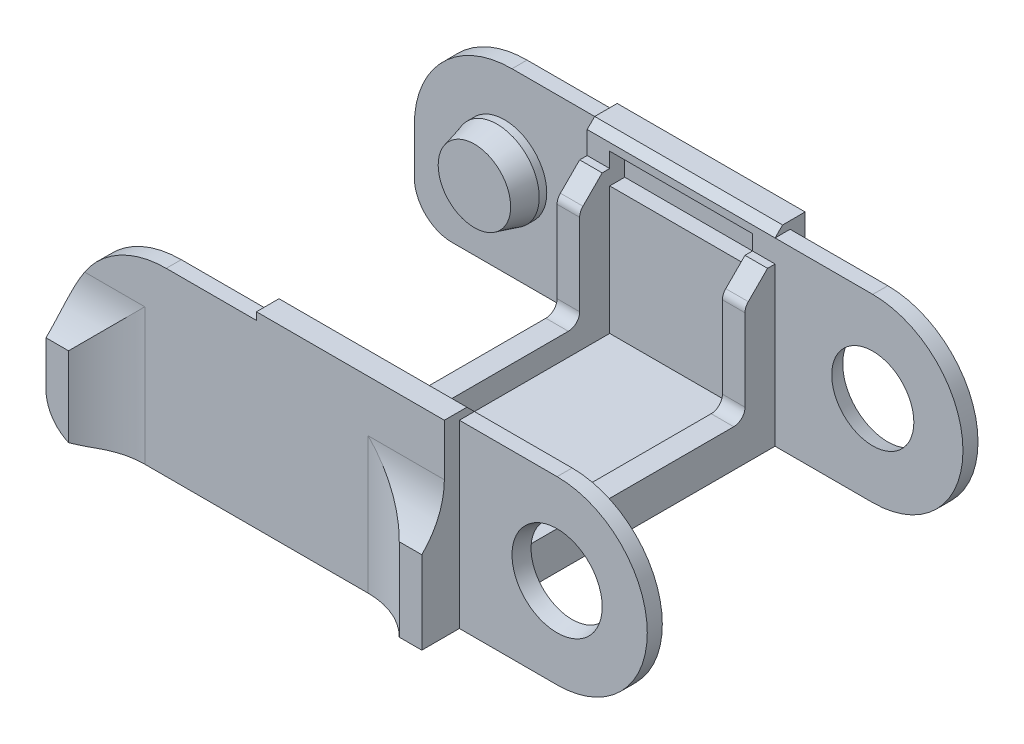
from build123d import *

# Parameters (mm, degrees)
SKETCH_1_W             = 25
SKETCH_1_H             = 25
EXTRUDE_1_DEPTH        = 4
SKETCH_2_W             = 25
SKETCH_2_H             = 24
EXTRUDE_2_DEPTH        = 2
SKETCH_3_R             = 5.625
EXTRUDE_3_DEPTH        = 4
CHAMFER_1_SIZE         = 3
CHAMFER_1_SIZE2        = 0.803847577
EXTRUDE_4_DEPTH        = 2
SKETCH_6_R             = 5
CUT_EXTRUDE_2_DEPTH    = 10
EXTRUDE_6_DEPTH        = 20
SKETCH_9_W             = 19
SKETCH_9_H             = 3
CUT_EXTRUDE_4_DEPTH    = 2
CHAMFER_2_SIZE         = 1
CHAMFER_3_SIZE         = 3.732050808
CHAMFER_3_SIZE_2       = 1
FILLET_1_R             = 13
CHAMFER_4_SIZE         = 1
SKETCH_11_W            = 3
SKETCH_11_H            = 4
EXTRUDE_7_DEPTH        = 16
PATTERN_LINEAR_1_COUNT = 2
PATTERN_LINEAR_1_PITCH = 22
CHAMFER_6_SIZE         = 3
FILLET_2_R             = 1.5
SKETCH1_W              = 3
SKETCH1_H              = 11
BOSS_EXTRUDE1_DEPTH    = 3
FILLET1_R              = 10
SKETCH2_W              = 3
SKETCH2_H              = 11
BOSS_EXTRUDE2_DEPTH    = 3
FILLET2_R              = 10
FILLET3_R              = 5


with BuildPart() as part:
    # Эскиз1 → Бобышка-Вытянуть1 (new body)
    with BuildSketch(Plane.XY):
        with Locations((-26.279531703, 11.219512195)):
            Rectangle(SKETCH_1_W, SKETCH_1_H)
    extrude(amount=EXTRUDE_1_DEPTH)

    # Эскиз2 → Бобышка-Вытянуть2 (add)
    with BuildSketch(Plane(origin=(0, 0, 0), x_dir=(-1, 0, 0), z_dir=(0, 0, -1))):
        with Locations((51.279531703, 10.719512195)):
            Rectangle(SKETCH_2_W, SKETCH_2_H)
    extrude(amount=-EXTRUDE_2_DEPTH)

    # Эскиз3 → Бобышка-Вытянуть3 (add)
    with BuildSketch(Plane.XY.offset(2)):
        with Locations((-51.779531703, 10.719512195)):
            Circle(SKETCH_3_R)
    extrude(amount=EXTRUDE_3_DEPTH)

    # Фаска1
    chamfer_1_edges = [part.edges().sort_by_distance(p)[0] for p in [
        (-57.404531703, 10.719512195, 6),
    ]]
    chamfer_1_side = [part.faces().sort_by_distance(p)[0] for p in [
        (-57.404531703, 10.719512195, 4),
    ]]
    chamfer(chamfer_1_edges, length=CHAMFER_1_SIZE, length2=CHAMFER_1_SIZE2, reference=chamfer_1_side[0])

    # Эскиз5 → Бобышка-Вытянуть4 (add)
    with BuildSketch(Plane.XY.offset(4)):
        with BuildLine():
            Line((-18.981970926, 22.719512195), (-0.779531703, 22.719512195))
            ThreePointArc((-0.779531703, 22.719512195), (11.220468297, 10.719512195), (-0.779531703, -1.280487805))
            Line((-0.779531703, -1.280487805), (-18.981970926, -1.280487805))
            ThreePointArc((-18.981970926, -1.280487805), (-30.981970926, 10.719512195), (-18.981970926, 22.719512195))
        make_face()
    extrude(amount=-EXTRUDE_4_DEPTH)

    # Эскиз6 → Вырез-Вытянуть2 (cut)
    with BuildSketch(Plane(origin=(0, 0, 2), x_dir=(-1, 0, 0), z_dir=(0, 0, -1))):
        with Locations((0.779531703, 10.719512195)):
            Circle(SKETCH_6_R)
    extrude(amount=-CUT_EXTRUDE_2_DEPTH, mode=Mode.SUBTRACT)

    # Эскиз8 → Бобышка-Вытянуть6 (add)
    with BuildSketch(Plane.XY.offset(4)):
        Polygon((-38.779531703, 3.719512195), (-35.779531703, 3.719512195), (-35.779531703, 0.719512195), (-16.779531703, 0.719512195), (-16.779531703, 3.719512195), (-13.779531703, 3.719512195), (-13.779531703, -1.280487805), (-38.779531703, -1.280487805), align=None)
    extrude(amount=EXTRUDE_6_DEPTH)

    # Эскиз9 → Вырез-Вытянуть4 (cut)
    with BuildSketch(Plane.XY.offset(4)):
        with Locations((-26.279531703, 19.219512195)):
            Rectangle(SKETCH_9_W, SKETCH_9_H)
    extrude(amount=-CUT_EXTRUDE_4_DEPTH, mode=Mode.SUBTRACT)

    # Фаска2
    chamfer_2_edges = [part.edges().sort_by_distance(p)[0] for p in [
        (-26.279531703, 20.719512195, 4),
    ]]
    chamfer(chamfer_2_edges, length=CHAMFER_2_SIZE)

    # Фаска3
    # the kernel refuses this chamfer: 3.732050808, 1 mm, written as the material it takes off along each edge
    with BuildSketch(Plane(origin=(-0.779531703, 10.719512195, 2), x_dir=(-1, 0, 0), z_dir=(0, -1, 0))) as chamfer_3_piece_1:
        Polygon((5, -CHAMFER_3_SIZE), (5 + CHAMFER_3_SIZE_2, 0), (5, 0), align=None)
    revolve(axis=Axis((-0.779531703, 10.719512195, 2), (0, 0, -1)), mode=Mode.SUBTRACT)

    # Скругление1
    fillet_1_edges = [part.edges().sort_by_distance(p)[0] for p in [
        (-63.779531703, 22.719512195, 1),
    ]]
    fillet(fillet_1_edges, radius=FILLET_1_R)

    # Фаска4
    chamfer_4_edges = [part.edges().sort_by_distance(p)[0] for p in [
        (-26.279531703, 23.719512195, 4),
    ]]
    chamfer(chamfer_4_edges, length=CHAMFER_4_SIZE)

    # Эскиз11 → Бобышка-Вытянуть7 (add)
    with BuildSketch(Plane(origin=(0, 3.719512195, 0), x_dir=(1, 0, 0), z_dir=(0, 1, 0))):
        with Locations((-37.279531703, -6)):
            Rectangle(SKETCH_11_W, SKETCH_11_H)
    extrude_7 = extrude(amount=EXTRUDE_7_DEPTH)

    # Линейный массив1: Бобышка-Вытянуть7 ×2
    with Locations(*[(i * PATTERN_LINEAR_1_PITCH, 0, 0) for i in range(1, PATTERN_LINEAR_1_COUNT)]):
        add(extrude_7)

    # Фаска6
    chamfer_6_edges = [part.edges().sort_by_distance(p)[0] for p in [
        (-37.279531703, 19.719512195, 8),
        (-15.279531703, 19.719512195, 8),
    ]]
    chamfer(chamfer_6_edges, length=CHAMFER_6_SIZE)

    # Скругление2
    fillet_2_edges = [part.edges().sort_by_distance(p)[0] for p in [
        (-37.279531703, 3.719512195, 8),
        (-15.279531703, 3.719512195, 8),
        (-15.279531703, 16.719512195, 8),
        (-37.279531703, 16.719512195, 8),
    ]]
    fillet(fillet_2_edges, radius=FILLET_2_R)

    # Sketch1 → Boss-Extrude1 (add)
    with BuildSketch(Plane(origin=(0, 0, 0), x_dir=(-1, 0, 0), z_dir=(0, 0, -1))):
        with Locations((15.279531703, 4.219512195)):
            Rectangle(SKETCH1_W, SKETCH1_H)
    extrude(amount=BOSS_EXTRUDE1_DEPTH)

    # Fillet1
    # the kernel refuses this fillet: 10 mm, written as the material it adds along each edge
    with BuildSketch(Plane(origin=(-16.779531703, 9.719512195, 0), x_dir=(-1, 0, 0), z_dir=(0, -1, 0))) as fillet1_piece_1:
        with BuildLine():
            CenterArc((7.141428429, 10), FILLET1_R, 224.427004001, 45.572995999)
            Line((0, 3), (-0.142828569, 2.86))
            ThreePointArc((-0.142828569, 2.86), (-0.2, 1.5), (-0.2, 0))
            Line((-0.2, 0), (0, -0.2))
            Line((0, -0.2), (7.141428429, -0.2))
            Line((7.141428429, -0.2), (7.141428429, 0))
        make_face()
    extrude(amount=11)
    with BuildSketch(Plane(origin=(-13.779531703, 9.719512195, 0), x_dir=(0, 1, 0), z_dir=(-1, 0, 0))) as fillet1_piece_2:
        with BuildLine():
            CenterArc((7.141428429, 10), FILLET1_R, 224.427004001, 45.572995999)
            Line((0, 3), (-0.142828569, 2.86))
            ThreePointArc((-0.142828569, 2.86), (-0.2, 1.5), (-0.2, 0))
            Line((-0.2, 0), (0, -0.2))
            Line((0, -0.2), (7.141428429, -0.2))
            Line((7.141428429, -0.2), (7.141428429, 0))
        make_face()
    extrude(amount=3)
    with BuildSketch(Plane(origin=(-16.779531703, 27.573083266, 0), x_dir=(-1, 0, 0), z_dir=(0, -1, 0))) as fillet1_piece_3a_section:
        with BuildLine():
            CenterArc((7.141428429, 10), FILLET1_R, 224.427004001, 45.572995999)
            Line((0, 3), (-0.142828569, 2.86))
            ThreePointArc((-0.142828569, 2.86), (-0.2, 1.5), (-0.2, 0))
            Line((-0.2, 0), (0, -0.2))
            Line((0, -0.2), (7.141428429, -0.2))
            Line((7.141428429, -0.2), (7.141428429, 0))
        make_face()
    fillet1_piece_3a = extrude(amount=28.853571071, mode=Mode.PRIVATE)
    fillet1_piece_3a = split(fillet1_piece_3a, bisect_by=Plane(origin=(-16.779531703, 23.719512195, 0), z_dir=(0, -1, 0)), keep=Keep.TOP, mode=Mode.PRIVATE)
    fillet1_piece_3a = split(fillet1_piece_3a, bisect_by=Plane(origin=(-16.779531703, 9.719512195, 0), z_dir=(0, 1, 0)), keep=Keep.TOP, mode=Mode.PRIVATE)
    with BuildSketch(Plane(origin=(-13.779531703, 9.719512195, 0), x_dir=(0, 1, 0), z_dir=(-1, 0, 0))) as fillet1_piece_3b_section:
        with BuildLine():
            CenterArc((7.141428429, 10), FILLET1_R, 224.427004001, 45.572995999)
            Line((0, 3), (-0.142828569, 2.86))
            ThreePointArc((-0.142828569, 2.86), (-0.2, 1.5), (-0.2, 0))
            Line((-0.2, 0), (0, -0.2))
            Line((0, -0.2), (7.141428429, -0.2))
            Line((7.141428429, -0.2), (7.141428429, 0))
        make_face()
    fillet1_piece_3b = extrude(amount=20.853571071, mode=Mode.PRIVATE)
    fillet1_piece_3b = split(fillet1_piece_3b, bisect_by=Plane(origin=(-16.779531703, 9.719512195, 0), z_dir=(-1, 0, 0)), keep=Keep.TOP, mode=Mode.PRIVATE)
    fillet1_piece_3 = fillet1_piece_3a & fillet1_piece_3b
    add(fillet1_piece_3)

    # Sketch2 → Boss-Extrude2 (add)
    with BuildSketch(Plane(origin=(0, 0, 0), x_dir=(-1, 0, 0), z_dir=(0, 0, -1))):
        with Locations((62.279531703, 4.219512195)):
            Rectangle(SKETCH2_W, SKETCH2_H)
    extrude(amount=BOSS_EXTRUDE2_DEPTH)

    # Fillet2
    # the kernel refuses this fillet: 10 mm, written as the material it adds along each edge
    with BuildSketch(Plane(origin=(-60.779531703, 9.719512195, 0), x_dir=(0, 1, 0), z_dir=(-1, 0, 0))) as fillet2_piece_1_section:
        with BuildLine():
            CenterArc((7.141428429, 10), FILLET2_R, 224.427004001, 45.572995999)
            Line((0, 3), (0, 0))
            Line((0, 0), (7.141428429, 0))
        make_face()
    fillet2_piece_1 = extrude(amount=20.853571071, mode=Mode.PRIVATE)
    fillet2_piece_1 = fillet2_piece_1 & Plane(origin=(-50.779531703, 9.719512195, 0), x_dir=(0, 1, 0), z_dir=(0, 0, 1)) * Cylinder(13, 71, mode=Mode.PRIVATE)
    add(fillet2_piece_1)
    with BuildSketch(Plane(origin=(-60.779531703, -1.280487805, 0), x_dir=(1, 0, 0), z_dir=(0, 1, 0))) as fillet2_piece_2:
        with BuildLine():
            CenterArc((7.141428429, 10), FILLET2_R, 224.427004001, 45.572995999)
            Line((0, 3), (0, 0))
            Line((0, 0), (7.141428429, 0))
        make_face()
    extrude(amount=11)
    with BuildSketch(Plane(origin=(-42.925960632, 9.719512195, 0), x_dir=(0, 1, 0), z_dir=(-1, 0, 0))) as fillet2_piece_3a_section:
        with BuildLine():
            CenterArc((7.141428429, 10), FILLET2_R, 224.427004001, 45.572995999)
            Line((0, 3), (0, 0))
            Line((0, 0), (7.141428429, 0))
        make_face()
    fillet2_piece_3a = extrude(amount=20.853571071, mode=Mode.PRIVATE)
    fillet2_piece_3a = split(fillet2_piece_3a, bisect_by=Plane(origin=(-60.779531703, 9.719512195, 0), z_dir=(1, 0, 0)), keep=Keep.TOP, mode=Mode.PRIVATE)
    with BuildSketch(Plane(origin=(-60.779531703, -1.280487805, 0), x_dir=(1, 0, 0), z_dir=(0, 1, 0))) as fillet2_piece_3b_section:
        with BuildLine():
            CenterArc((7.141428429, 10), FILLET2_R, 224.427004001, 45.572995999)
            Line((0, 3), (0, 0))
            Line((0, 0), (7.141428429, 0))
        make_face()
    fillet2_piece_3b = extrude(amount=28.853571071, mode=Mode.PRIVATE)
    fillet2_piece_3b = fillet2_piece_3b & Plane(origin=(-50.779531703, 9.719512195, 0), x_dir=(0, 1, 0), z_dir=(0, 0, 1)) * Cylinder(13, 87, mode=Mode.PRIVATE)
    fillet2_piece_3b = split(fillet2_piece_3b, bisect_by=Plane(origin=(-60.779531703, 9.719512195, 0), z_dir=(0, 1, 0)), keep=Keep.TOP, mode=Mode.PRIVATE)
    fillet2_piece_3 = fillet2_piece_3a & fillet2_piece_3b
    add(fillet2_piece_3)

    # Fillet3
    fillet3_edges = [part.edges().sort_by_distance(p)[0] for p in [
        (-63.779531703, -1.280487805, -0.5),
    ]]
    fillet(fillet3_edges, radius=FILLET3_R)

    # Зеркальное отражение1: part across plane


with BuildPart() as part_1:
    add(part.part)
    add(part.part.mirror(Plane(origin=(0, 0, 24), x_dir=(1, 0, 0), z_dir=(0, 0, -1))))


solid = part_1.part
